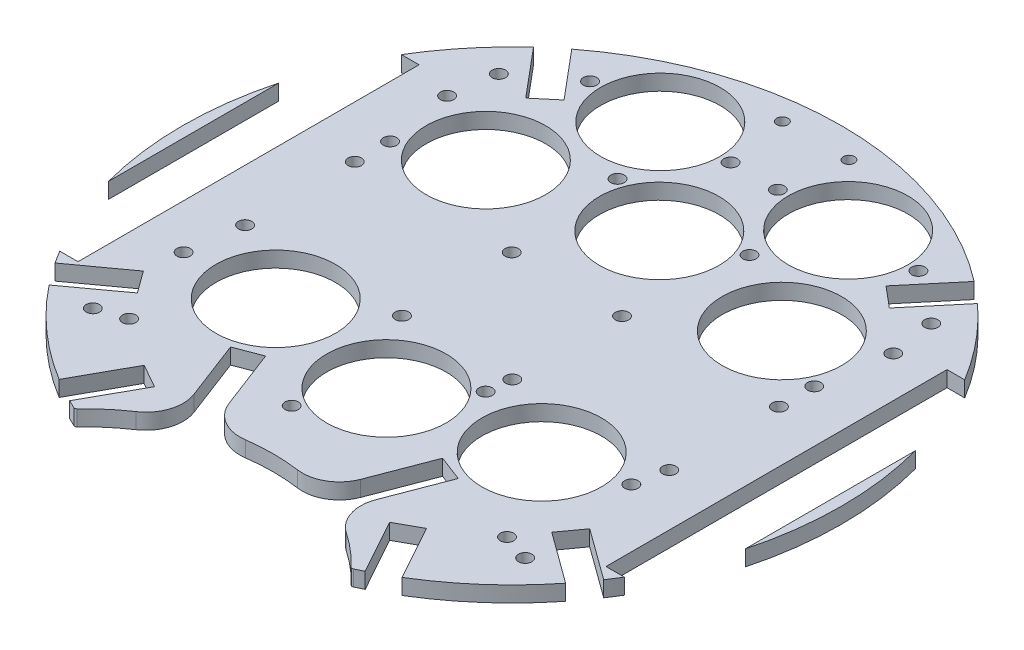
from build123d import *

# Parameters (mm, degrees)
BOSS_EXTRUDE2_OUTLINE_R   = 1.35
BOSS_EXTRUDE2_OUTLINE_W   = 11
BOSS_EXTRUDE2_OUTLINE_H   = 69
BOSS_EXTRUDE2_OUTLINE_R_2 = 12.095
BOSS_EXTRUDE2_OUTLINE_R_3 = 1.143
BOSS_EXTRUDE2_DEPTH       = 3.175
SKETCH2_R                 = 88.186521352
SKETCH2_R_2               = 66.668884373
CUT_EXTRUDE2_DEPTH        = 10
FILLET1_R                 = 0.5


# Read off the part's stored shape, not the designer's step: Boss-Extrude2
with BuildPart() as part:
    # Boss-Extrude2 outline → Boss-Extrude2 (new body)
    with BuildSketch(Plane(origin=(0, 0, 0), x_dir=(1, 0, 0), z_dir=(0, 1, 0))):
        with BuildLine():
            ThreePointArc((-13.319120077, -43.925216134), (-10.126305957, -47.701325441), (-5.276948898, -48.669209533))
            ThreePointArc((-5.276948898, -48.669209533), (0, -48.302004425), (5.276948898, -48.669209533))
            ThreePointArc((5.276948898, -48.669209533), (10.126305957, -47.701325441), (13.319120077, -43.925216134))
            Line((13.319120077, -43.925216134), (17.904063474, -31.950549264))
            Line((17.904063474, -31.950549264), (23.040433069, -33.917198033))
            Line((23.040433069, -33.917198033), (18.455489673, -45.891864903))
            ThreePointArc((18.455489673, -45.891864903), (18.309924074, -50.834725832), (21.272807595, -54.79381471))
            ThreePointArc((21.272807595, -54.79381471), (26.466137741, -58.99482374), (30.845959646, -64.038266509))
            ThreePointArc((30.845959646, -64.038266509), (30.722917613, -61.793165345), (29.939937248, -59.685427143))
            Line((29.939937248, -59.685427143), (23.761921217, -48.539993511))
            Line((23.761921217, -48.539993511), (28.572329606, -45.873540599))
            Line((28.572329606, -45.873540599), (34.750345491, -57.018976288))
            ThreePointArc((34.750345491, -57.018976288), (39.797694407, -60.728851606), (45.899993549, -59.314337155))
            ThreePointArc((45.899993549, -59.314337155), (49.682691748, -56.183895741), (53.252452412, -52.812652955))
            ThreePointArc((53.252452412, -52.812652955), (55.400241506, -46.895968251), (52.284336639, -41.426846498))
            Line((52.284336639, -41.426846498), (41.919203487, -33.87844485))
            Line((41.919203487, -33.87844485), (45.152040904, -29.428864843))
            Line((45.152040904, -29.428864843), (55.532494673, -36.970706015))
            ThreePointArc((55.532494673, -36.970706015), (61.693781059, -38.244294688), (66.657056834, -34.377852961))
            ThreePointArc((66.657056834, -34.377852961), (74.442262703, 9.129596032), (56.374397975, 49.466425512))
            ThreePointArc((56.374397975, 49.466425512), (50.654117331, 52.01932544), (44.991624855, 49.340690033))
            Line((44.991624855, 49.340690033), (36.78429665, 39.55957716))
            Line((36.78429665, 39.55957716), (32.571052213, 43.094909013))
            Line((32.571052213, 43.094909013), (40.778380417, 52.876021886))
            ThreePointArc((40.778380417, 52.876021886), (42.433039833, 58.917628535), (38.925607882, 64.107698843))
            ThreePointArc((38.925607882, 64.107698843), (0, 75), (-38.925607882, 64.107698843))
            ThreePointArc((-38.925607882, 64.107698843), (-42.433039833, 58.917628535), (-40.778380417, 52.876021886))
            Line((-40.778380417, 52.876021886), (-32.571052213, 43.094909013))
            Line((-32.571052213, 43.094909013), (-36.78429665, 39.55957716))
            Line((-36.78429665, 39.55957716), (-44.991624855, 49.340690033))
            ThreePointArc((-44.991624855, 49.340690033), (-50.654117331, 52.01932544), (-56.374397975, 49.466425512))
            ThreePointArc((-56.374397975, 49.466425512), (-74.442262703, 9.129596032), (-66.657056834, -34.377852961))
            ThreePointArc((-66.657056834, -34.377852961), (-61.693781059, -38.244294688), (-55.532494673, -36.970706015))
            Line((-55.532494673, -36.970706015), (-45.152040904, -29.428864843))
            Line((-45.152040904, -29.428864843), (-41.919203487, -33.87844485))
            Line((-41.919203487, -33.87844485), (-52.284336639, -41.426846498))
            ThreePointArc((-52.284336639, -41.426846498), (-55.400241506, -46.895968251), (-53.252452412, -52.812652955))
            ThreePointArc((-53.252452412, -52.812652955), (-49.682691748, -56.183895741), (-45.899993549, -59.314337155))
            ThreePointArc((-45.899993549, -59.314337155), (-39.797694407, -60.728851606), (-34.750345491, -57.018976288))
            Line((-34.750345491, -57.018976288), (-28.572329606, -45.873540599))
            Line((-28.572329606, -45.873540599), (-23.761921217, -48.539993511))
            Line((-23.761921217, -48.539993511), (-29.939937248, -59.685427143))
            ThreePointArc((-29.939937248, -59.685427143), (-30.722917613, -61.793165345), (-30.845959646, -64.038266509))
            ThreePointArc((-30.845959646, -64.038266509), (-26.466137741, -58.99482374), (-21.272807595, -54.79381471))
            ThreePointArc((-21.272807595, -54.79381471), (-18.309924074, -50.834725832), (-18.455489673, -45.891864903))
            Line((-18.455489673, -45.891864903), (-23.040433069, -33.917198033))
            Line((-23.040433069, -33.917198033), (-17.904063474, -31.950549264))
            Line((-17.904063474, -31.950549264), (-13.319120077, -43.925216134))
        make_face()
        with Locations((-43.735655662, -41.075447944)):
            Circle(BOSS_EXTRUDE2_OUTLINE_R, mode=Mode.SUBTRACT)
        with Locations((-38.234289702, -39.23697625)):
            Circle(BOSS_EXTRUDE2_OUTLINE_R, mode=Mode.SUBTRACT)
        with Locations((-6.55476095, -38.026099982)):
            Circle(BOSS_EXTRUDE2_OUTLINE_R, mode=Mode.SUBTRACT)
        with Locations((-44.385223141, -22.074211772)):
            Circle(BOSS_EXTRUDE2_OUTLINE_R, mode=Mode.SUBTRACT)
        with Locations((-58.910067426, 0.102907352)):
            Rectangle(BOSS_EXTRUDE2_OUTLINE_W, BOSS_EXTRUDE2_OUTLINE_H, mode=Mode.SUBTRACT)
        with Locations((-42.910067426, -11.1)):
            Circle(BOSS_EXTRUDE2_OUTLINE_R, mode=Mode.SUBTRACT)
        with Locations((-26.905821676, -20.904643604)):
            Circle(BOSS_EXTRUDE2_OUTLINE_R_2, mode=Mode.SUBTRACT)
        with Locations((-11.160067426, -11.1)):
            Circle(BOSS_EXTRUDE2_OUTLINE_R, mode=Mode.SUBTRACT)
        with Locations((38.234289702, -39.23697625)):
            Circle(BOSS_EXTRUDE2_OUTLINE_R, mode=Mode.SUBTRACT)
        with Locations((43.735655662, -41.075447944)):
            Circle(BOSS_EXTRUDE2_OUTLINE_R, mode=Mode.SUBTRACT)
        with Locations((0, -25.409190322)):
            Circle(BOSS_EXTRUDE2_OUTLINE_R_2, mode=Mode.SUBTRACT)
        with Locations((10.597026674, -15.930038136)):
            Circle(BOSS_EXTRUDE2_OUTLINE_R, mode=Mode.SUBTRACT)
        with Locations((26.905821676, -20.904643604)):
            Circle(BOSS_EXTRUDE2_OUTLINE_R_2, mode=Mode.SUBTRACT)
        with Locations((11.160067426, -11.1)):
            Circle(BOSS_EXTRUDE2_OUTLINE_R, mode=Mode.SUBTRACT)
        with Locations((41.601681906, -17.457756634)):
            Circle(BOSS_EXTRUDE2_OUTLINE_R, mode=Mode.SUBTRACT)
        with Locations((42.910067426, -11.1)):
            Circle(BOSS_EXTRUDE2_OUTLINE_R, mode=Mode.SUBTRACT)
        with Locations((58.910067426, 0.102907352)):
            Rectangle(BOSS_EXTRUDE2_OUTLINE_W, BOSS_EXTRUDE2_OUTLINE_H, mode=Mode.SUBTRACT)
        with Locations((-42.910067426, 11.1)):
            Circle(BOSS_EXTRUDE2_OUTLINE_R, mode=Mode.SUBTRACT)
        with Locations((-42.910067426, 18.234848025)):
            Circle(BOSS_EXTRUDE2_OUTLINE_R, mode=Mode.SUBTRACT)
        with Locations((-45.13872464, 31.997163897)):
            Circle(BOSS_EXTRUDE2_OUTLINE_R, mode=Mode.SUBTRACT)
        with Locations((-11.160067426, 11.1)):
            Circle(BOSS_EXTRUDE2_OUTLINE_R, mode=Mode.SUBTRACT)
        with Locations((-29.939937248, 24.651901309)):
            Circle(BOSS_EXTRUDE2_OUTLINE_R_2, mode=Mode.SUBTRACT)
        with Locations((-13.346873881, 34.693819966)):
            Circle(BOSS_EXTRUDE2_OUTLINE_R, mode=Mode.SUBTRACT)
        with Locations((-43.735655662, 41.075447944)):
            Circle(BOSS_EXTRUDE2_OUTLINE_R, mode=Mode.SUBTRACT)
        with Locations((-33.21799214, 49)):
            Circle(BOSS_EXTRUDE2_OUTLINE_R, mode=Mode.SUBTRACT)
        with Locations((-19, 49)):
            Circle(BOSS_EXTRUDE2_OUTLINE_R_2, mode=Mode.SUBTRACT)
        with Locations((-4.78200786, 49)):
            Circle(BOSS_EXTRUDE2_OUTLINE_R, mode=Mode.SUBTRACT)
        with Locations((-6.731, 61.422565207)):
            Circle(BOSS_EXTRUDE2_OUTLINE_R_3, mode=Mode.SUBTRACT)
        with Locations((11.160067426, 11.1)):
            Circle(BOSS_EXTRUDE2_OUTLINE_R, mode=Mode.SUBTRACT)
        with Locations((0, 29.793589551)):
            Circle(BOSS_EXTRUDE2_OUTLINE_R_2, mode=Mode.SUBTRACT)
        with Locations((13.346873881, 34.693819966)):
            Circle(BOSS_EXTRUDE2_OUTLINE_R, mode=Mode.SUBTRACT)
        with Locations((29.939937248, 24.651901309)):
            Circle(BOSS_EXTRUDE2_OUTLINE_R_2, mode=Mode.SUBTRACT)
        with Locations((42.910067426, 11.1)):
            Circle(BOSS_EXTRUDE2_OUTLINE_R, mode=Mode.SUBTRACT)
        with Locations((42.910067426, 18.234848025)):
            Circle(BOSS_EXTRUDE2_OUTLINE_R, mode=Mode.SUBTRACT)
        with Locations((45.13872464, 31.997163897)):
            Circle(BOSS_EXTRUDE2_OUTLINE_R, mode=Mode.SUBTRACT)
        with Locations((4.78200786, 49)):
            Circle(BOSS_EXTRUDE2_OUTLINE_R, mode=Mode.SUBTRACT)
        with Locations((19, 49)):
            Circle(BOSS_EXTRUDE2_OUTLINE_R_2, mode=Mode.SUBTRACT)
        with Locations((33.21799214, 49)):
            Circle(BOSS_EXTRUDE2_OUTLINE_R, mode=Mode.SUBTRACT)
        with Locations((6.731, 61.422565207)):
            Circle(BOSS_EXTRUDE2_OUTLINE_R_3, mode=Mode.SUBTRACT)
        with Locations((43.735655662, 41.075447944)):
            Circle(BOSS_EXTRUDE2_OUTLINE_R, mode=Mode.SUBTRACT)
    extrude(amount=BOSS_EXTRUDE2_DEPTH)

    # Sketch2 → Cut-Extrude2 (cut)
    with BuildSketch(Plane(origin=(0, 3.175, 0), x_dir=(1, 0, 0), z_dir=(0, 1, 0))):
        Circle(SKETCH2_R)
        Circle(SKETCH2_R_2, mode=Mode.SUBTRACT)
    extrude(amount=-CUT_EXTRUDE2_DEPTH, mode=Mode.SUBTRACT)


with BuildPart() as cut_extrude2_piece_1:
    # of the separate pieces the step leaves, piece 1, a body of its own (cut_extrude2_pieces)
    add(part.part.solids().sort_by_distance((-36.78429665, 0, -39.55957716))[0])

    # Fillet1
    fillet1_edges = [cut_extrude2_piece_1.edges().sort_by_distance(p)[0] for p in [
        (-27.961277889, 1.5875, 60.521955375),
        (27.961277889, 1.5875, 60.521955375),
    ]]
    fillet(fillet1_edges, radius=FILLET1_R)


with BuildPart() as cut_extrude2_piece_2:
    # of the separate pieces the step leaves, piece 2, a body of its own (cut_extrude2_pieces)
    add(part.part.solids().sort_by_distance((-64.410067426, 0, 17.207072898))[0])


with BuildPart() as cut_extrude2_piece_3:
    # of the separate pieces the step leaves, piece 3, a body of its own (cut_extrude2_pieces)
    add(part.part.solids().sort_by_distance((64.410067426, 0, -17.207072898))[0])


solid = Compound([cut_extrude2_piece_1.part, cut_extrude2_piece_2.part, cut_extrude2_piece_3.part])
